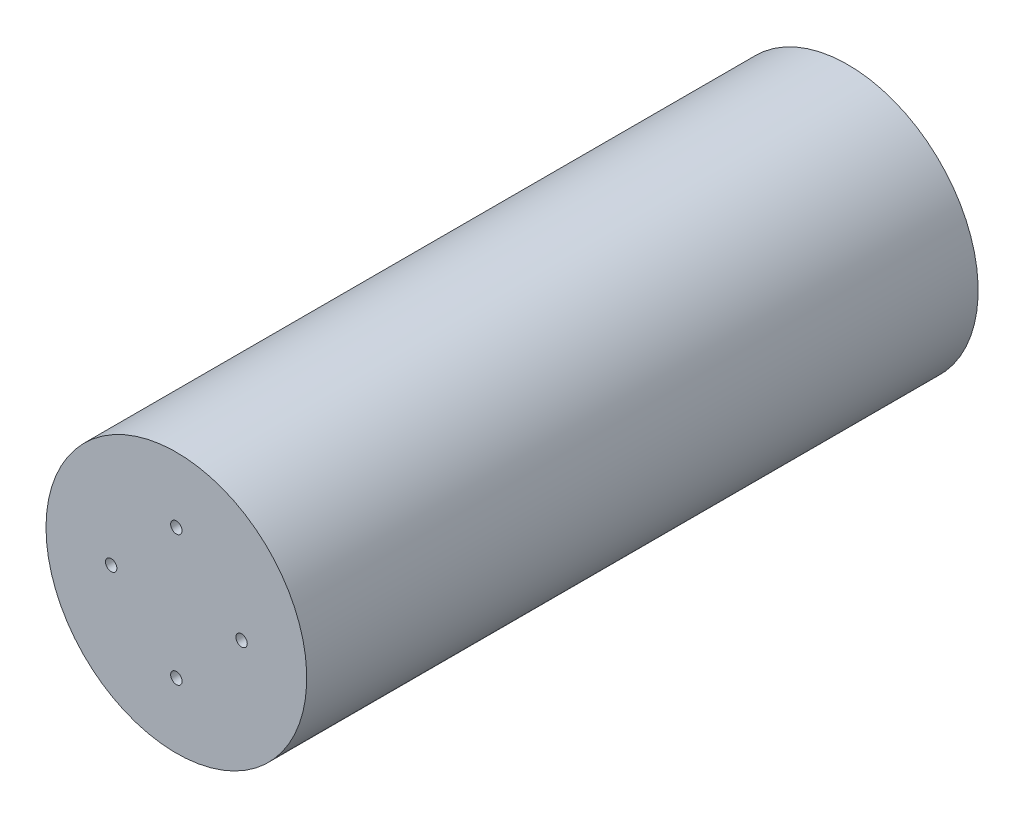
from build123d import *

# Parameters (mm, degrees)
CROQUIS1_W                  = 248.76
CROQUIS1_H                  = 195
SALIENTE_EXTRUIR1_DEPTH     = 5
CROQUIS2_W                  = 48
CROQUIS2_H                  = 30
CROQUIS2_W_2                = 30
CORTAR_EXTRUIR1_DEPTH       = 2
CROQUIS3_R                  = 2.375
CORTAR_EXTRUIR2_DEPTH       = 10
CROQUIS4_R                  = 40
SALIENTE_EXTRUIR2_DEPTH     = 206
CROQUIS5_R                  = 12.5
CORTAR_EXTRUIR3_DEPTH       = 10
CROQUIS12_W                 = 12
CROQUIS12_H                 = 30
SALIENTE_EXTRUIR3_DEPTH     = 4
REDONDEO1_R                 = 10
REDONDEO2_R                 = 10
REDONDEO3_R                 = 10
CORTAR_EXTRUIR5_DEPTH       = 262.677217236
CORTAR_EXTRUIR5_DEPTH_BACK  = 262.677217236
CROQUIS13_R                 = 1.625
CORTAR_EXTRUIR7_DEPTH       = 2
CROQUIS16_R                 = 1.75
CORTAR_EXTRUIR9_DEPTH       = 20
CORTAR_EXTRUIR17_DEPTH      = 313.64182726
CORTAR_EXTRUIR17_DEPTH_BACK = 313.64182726


with BuildPart() as part:
    # Croquis1 → Saliente-Extruir1 (new body)
    with BuildSketch(Plane.XY):
        with Locations((7.088293187, 0.26268)):
            Rectangle(CROQUIS1_W, CROQUIS1_H)
    extrude(amount=SALIENTE_EXTRUIR1_DEPTH)

    # Croquis2 → Cortar-Extruir1 (cut)
    with BuildSketch(Plane.XY.offset(5)):
        with Locations((-93.291706813, -82.23732)):
            Rectangle(CROQUIS2_W, CROQUIS2_H)
        with Locations((116.468293187, 82.76268)):
            Rectangle(CROQUIS2_W_2, CROQUIS2_H)
        with Locations((116.468293187, -82.23732)):
            Rectangle(CROQUIS2_W_2, CROQUIS2_H)
        with Locations((-93.291706813, 82.76268)):
            Rectangle(CROQUIS2_W, CROQUIS2_H)
    extrude(amount=-CORTAR_EXTRUIR1_DEPTH, mode=Mode.SUBTRACT)

    # Croquis3 → Cortar-Extruir2 (cut)
    with BuildSketch(Plane.XY.offset(5)):
        with Locations((-93.291706813, 83.76268)):
            Circle(CROQUIS3_R)
        with Locations((-93.291706813, -83.23732)):
            Circle(CROQUIS3_R)
        with Locations((116.468293187, 83.76268)):
            Circle(CROQUIS3_R)
        with Locations((116.468293187, -83.23732)):
            Circle(CROQUIS3_R)
    extrude(amount=-CORTAR_EXTRUIR2_DEPTH, mode=Mode.SUBTRACT)

    # Croquis4 → Saliente-Extruir2 (add)
    with BuildSketch(Plane(origin=(0, 0, 0), x_dir=(-1, 0, 0), z_dir=(0, 0, -1))):
        with Locations((55.101706813, 0.26268)):
            Circle(CROQUIS4_R)
    extrude(amount=SALIENTE_EXTRUIR2_DEPTH)

    # Croquis5 → Cortar-Extruir3 (cut)
    with BuildSketch(Plane(origin=(0, 0, 0), x_dir=(-1, 0, 0), z_dir=(0, 0, -1))):
        with Locations((-76.968293187, 0.26268)):
            Circle(CROQUIS5_R)
    extrude(amount=-CORTAR_EXTRUIR3_DEPTH, mode=Mode.SUBTRACT)

    # Croquis12 → Saliente-Extruir3 (add, symmetric)
    with BuildSketch(Plane(origin=(7.088293187, 0, 0), x_dir=(0, 0, -1), z_dir=(1, 0, 0))):
        with Locations((6, 82.76268)):
            Rectangle(CROQUIS12_W, CROQUIS12_H)
        with Locations((6, -82.23732)):
            Rectangle(CROQUIS12_W, CROQUIS12_H)
    extrude(amount=SALIENTE_EXTRUIR3_DEPTH, both=True)

    # Redondeo1
    redondeo1_edges = [part.edges().sort_by_distance(p)[0] for p in [
        (7.088293187, -67.23732, 0),
        (7.088293187, 67.76268, 0),
    ]]
    fillet(redondeo1_edges, radius=REDONDEO1_R)

    # Redondeo2
    redondeo2_edges = [part.edges().sort_by_distance(p)[0] for p in [
        (7.088293187, 67.76268, -12),
        (7.088293187, -67.23732, -12),
    ]]
    fillet(redondeo2_edges, radius=REDONDEO2_R)

    # Redondeo3
    redondeo3_edges = [part.edges().sort_by_distance(p)[0] for p in [
        (7.088293187, -97.23732, -12),
        (7.088293187, 97.76268, -12),
    ]]
    fillet(redondeo3_edges, radius=REDONDEO3_R)

    # Croquis13 → Cortar-Extruir5 (cut, two sides: drawn at the far end of the back side and taken through both)
    with BuildSketch(Plane(origin=(11.088293187, 0, 0), x_dir=(0, 0, -1), z_dir=(1, 0, 0)).offset(-CORTAR_EXTRUIR5_DEPTH_BACK)):
        with Locations((6, 87.76268)):
            Circle(CROQUIS13_R)
        with Locations((6, 77.76268)):
            Circle(CROQUIS13_R)
        with Locations((6, -77.23732)):
            Circle(CROQUIS13_R)
        with Locations((6, -87.23732)):
            Circle(CROQUIS13_R)
    extrude(amount=CORTAR_EXTRUIR5_DEPTH + CORTAR_EXTRUIR5_DEPTH_BACK, mode=Mode.SUBTRACT)

    # Croquis15 → Cortar-Extruir7 (cut)
    with BuildSketch(Plane.XY.offset(5)):
        Polygon((111.468293187, 67.76268), (131.468293187, 67.76268), (131.468293187, -67.23732), (111.468293187, -67.23732), (111.468293187, -59.48732), (125.218293187, -59.48732), (125.218293187, 60.01268), (111.468293187, 60.01268), align=None)
    extrude(amount=-CORTAR_EXTRUIR7_DEPTH, mode=Mode.SUBTRACT)

    # Croquis16 → Cortar-Extruir9 (cut)
    with BuildSketch(Plane.XY.offset(5)):
        with Locations((-55.101706813, 20.26268)):
            Circle(CROQUIS16_R)
        with Locations((-35.101706813, 0.26268)):
            Circle(CROQUIS16_R)
        with Locations((-55.101706813, -19.73732)):
            Circle(CROQUIS16_R)
        with Locations((-75.101706813, 0.26268)):
            Circle(CROQUIS16_R)
    extrude(amount=-CORTAR_EXTRUIR9_DEPTH, mode=Mode.SUBTRACT)

    # Croquis20 → Cortar-Extruir17 (cut, two sides: drawn at the far end of the back side and taken through both)
    with BuildSketch(Plane.XZ.offset(97.23732).offset(-CORTAR_EXTRUIR17_DEPTH_BACK)):
        Polygon((-117.291706813, 10.531534682), (-117.291706813, 0), (3.088293187, 0), (3.088293187, -12), (11.088293187, -12), (11.088293187, 0), (131.468293187, 0), (131.468293187, 10.531534682), align=None)
    extrude(amount=CORTAR_EXTRUIR17_DEPTH + CORTAR_EXTRUIR17_DEPTH_BACK, mode=Mode.SUBTRACT)


solid = part.part
